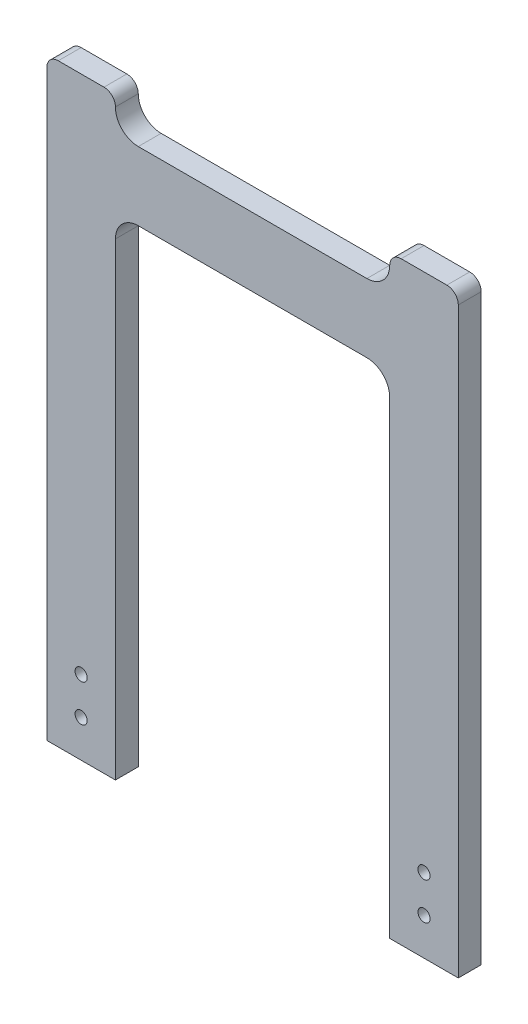
from build123d import *

# Parameters (mm, degrees)
BOSS_EXTRUDE1_DEPTH         = 12.7
F_1_4_CLEARANCE_HOLE1_D     = 6.7564
F_1_4_CLEARANCE_HOLE1_DEPTH = 219.964
F_1_4_CLEARANCE_HOLE1_TIP   = 2.029827343
FILLET1_R                   = 12.7
FILLET2_R                   = 6.35


with BuildPart() as part:
    # Sketch1 → Boss-Extrude1 (new body)
    with BuildSketch(Plane.XY):
        Polygon((-114.3, -31.75), (-76.2, -31.75), (-76.2, 241.3), (76.2, 241.3), (76.2, -31.75), (114.3, -31.75), (114.3, 298.45), (76.2, 298.45), (76.2, 279.4), (-76.2, 279.4), (-76.2, 298.45), (-114.3, 298.45), align=None)
    extrude(amount=BOSS_EXTRUDE1_DEPTH)

    # 1/4 Clearance Hole1
    with Locations(Plane.XY.offset(12.7)):
        with Locations((-95.25, -11.1125), (-95.25, 9.525), (95.25, -11.1125), (95.25, 9.525)):
            Hole(F_1_4_CLEARANCE_HOLE1_D / 2, depth=F_1_4_CLEARANCE_HOLE1_DEPTH)
            with Locations((0, 0, -(F_1_4_CLEARANCE_HOLE1_DEPTH + F_1_4_CLEARANCE_HOLE1_TIP / 2))):  # 118° drill point
                Cone(0, F_1_4_CLEARANCE_HOLE1_D / 2, F_1_4_CLEARANCE_HOLE1_TIP, mode=Mode.SUBTRACT)

    # Fillet1
    fillet1_edges = [part.edges().sort_by_distance(p)[0] for p in [
        (-76.2, 279.4, 6.35),
        (76.2, 279.4, 6.35),
        (76.2, 241.3, 6.35),
        (-76.2, 241.3, 6.35),
    ]]
    fillet(fillet1_edges, radius=FILLET1_R)

    # Fillet2
    fillet2_edges = [part.edges().sort_by_distance(p)[0] for p in [
        (114.3, 298.45, 6.35),
        (76.2, 298.45, 6.35),
        (-114.3, 298.45, 6.35),
        (-76.2, 298.45, 6.35),
    ]]
    fillet(fillet2_edges, radius=FILLET2_R - 0.0001)  # a hair under: the kernel refuses the full size


solid = part.part
